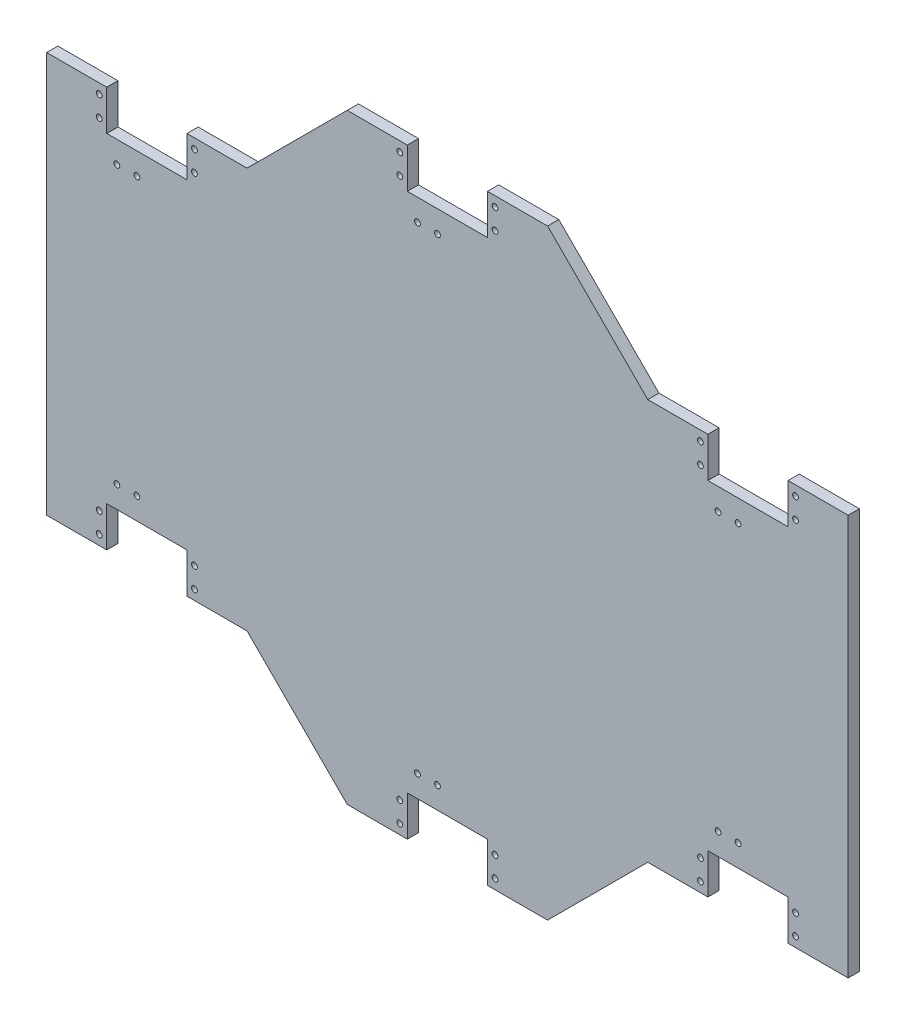
from build123d import *

# Parameters (mm, degrees)
BOSS_EXTRU_1_DEPTH      = 5.6
ENL_V_MAT_EXTRU_1_REACH = 429.237
ESQUISSE2_W             = 40
ESQUISSE2_H             = 20
ENL_V_MAT_EXTRU_2_REACH = 429.237
ESQUISSE3_R             = 1.45
SKETCH2_W               = 40
SKETCH2_H               = 20
CUT_EXTRUDE2_DEPTH      = 428.236889793
SKETCH5_R               = 1.45
CUT_EXTRUDE4_DEPTH      = 428.236889793


with BuildPart() as part:
    # Esquisse1 → Boss.-Extru.1 (new body)
    with BuildSketch(Plane.XY):
        Polygon((100, -100), (150, -150), (250, -150), (300, -100), (400, -100), (400, 0), (25.838605695, 0), (0, 0), (0, -100), align=None)
    boss_extru_1 = extrude(amount=BOSS_EXTRU_1_DEPTH)

    # Esquisse2 → Enlèv. mat.-Extru.1 (cut, up to next)
    with BuildSketch(Plane.XY.offset(5.6), mode=Mode.PRIVATE) as enl_v_mat_extru_1_sk1:
        with Locations((50, -90)):
            Rectangle(ESQUISSE2_W, ESQUISSE2_H)
    enl_v_mat_extru_1_tool1 = extrude(enl_v_mat_extru_1_sk1.sketch, amount=-ENL_V_MAT_EXTRU_1_REACH, mode=Mode.PRIVATE) & part.part
    enl_v_mat_extru_1 = enl_v_mat_extru_1_tool1.solids().sort_by_distance((50, -90, 5.6))[0]
    add(enl_v_mat_extru_1, mode=Mode.SUBTRACT)

    # Esquisse3 → Enlèv. mat.-Extru.2 (cut, up to next)
    with BuildSketch(Plane.XY.offset(5.6), mode=Mode.PRIVATE) as enl_v_mat_extru_2_sk1:
        with Locations((26.25, -95.08)):
            Circle(ESQUISSE3_R)
    enl_v_mat_extru_2_tool1 = extrude(enl_v_mat_extru_2_sk1.sketch, amount=-ENL_V_MAT_EXTRU_2_REACH, mode=Mode.PRIVATE) & part.part
    # Esquisse3 → Enlèv. mat.-Extru.2 (cut, up to next)
    with BuildSketch(Plane.XY.offset(5.6), mode=Mode.PRIVATE) as enl_v_mat_extru_2_sk2:
        with Locations((73.75, -95.08)):
            Circle(ESQUISSE3_R)
    enl_v_mat_extru_2_tool2 = extrude(enl_v_mat_extru_2_sk2.sketch, amount=-ENL_V_MAT_EXTRU_2_REACH, mode=Mode.PRIVATE) & part.part
    # Esquisse3 → Enlèv. mat.-Extru.2 (cut, up to next)
    with BuildSketch(Plane.XY.offset(5.6), mode=Mode.PRIVATE) as enl_v_mat_extru_2_sk3:
        with Locations((73.75, -84.92)):
            Circle(ESQUISSE3_R)
    enl_v_mat_extru_2_tool3 = extrude(enl_v_mat_extru_2_sk3.sketch, amount=-ENL_V_MAT_EXTRU_2_REACH, mode=Mode.PRIVATE) & part.part
    # Esquisse3 → Enlèv. mat.-Extru.2 (cut, up to next)
    with BuildSketch(Plane.XY.offset(5.6), mode=Mode.PRIVATE) as enl_v_mat_extru_2_sk4:
        with Locations((26.25, -84.92)):
            Circle(ESQUISSE3_R)
    enl_v_mat_extru_2_tool4 = extrude(enl_v_mat_extru_2_sk4.sketch, amount=-ENL_V_MAT_EXTRU_2_REACH, mode=Mode.PRIVATE) & part.part
    # Esquisse3 → Enlèv. mat.-Extru.2 (cut, up to next)
    with BuildSketch(Plane.XY.offset(5.6), mode=Mode.PRIVATE) as enl_v_mat_extru_2_sk5:
        with Locations((35.06, -69.09)):
            Circle(ESQUISSE3_R)
    enl_v_mat_extru_2_tool5 = extrude(enl_v_mat_extru_2_sk5.sketch, amount=-ENL_V_MAT_EXTRU_2_REACH, mode=Mode.PRIVATE) & part.part
    # Esquisse3 → Enlèv. mat.-Extru.2 (cut, up to next)
    with BuildSketch(Plane.XY.offset(5.6), mode=Mode.PRIVATE) as enl_v_mat_extru_2_sk6:
        with Locations((45.06, -69.09)):
            Circle(ESQUISSE3_R)
    enl_v_mat_extru_2_tool6 = extrude(enl_v_mat_extru_2_sk6.sketch, amount=-ENL_V_MAT_EXTRU_2_REACH, mode=Mode.PRIVATE) & part.part
    enl_v_mat_extru_2_1 = enl_v_mat_extru_2_tool1.solids().sort_by_distance((26.25, -95.08, 5.6))[0]
    add(enl_v_mat_extru_2_1, mode=Mode.SUBTRACT)
    enl_v_mat_extru_2_2 = enl_v_mat_extru_2_tool2.solids().sort_by_distance((73.75, -95.08, 5.6))[0]
    add(enl_v_mat_extru_2_2, mode=Mode.SUBTRACT)
    enl_v_mat_extru_2_3 = enl_v_mat_extru_2_tool3.solids().sort_by_distance((73.75, -84.92, 5.6))[0]
    add(enl_v_mat_extru_2_3, mode=Mode.SUBTRACT)
    enl_v_mat_extru_2_4 = enl_v_mat_extru_2_tool4.solids().sort_by_distance((26.25, -84.92, 5.6))[0]
    add(enl_v_mat_extru_2_4, mode=Mode.SUBTRACT)
    enl_v_mat_extru_2_5 = enl_v_mat_extru_2_tool5.solids().sort_by_distance((35.06, -69.09, 5.6))[0]
    add(enl_v_mat_extru_2_5, mode=Mode.SUBTRACT)
    enl_v_mat_extru_2_6 = enl_v_mat_extru_2_tool6.solids().sort_by_distance((45.06, -69.09, 5.6))[0]
    add(enl_v_mat_extru_2_6, mode=Mode.SUBTRACT)
    enl_v_mat_extru_2 = enl_v_mat_extru_2_1 + enl_v_mat_extru_2_2 + enl_v_mat_extru_2_3 + enl_v_mat_extru_2_4 + enl_v_mat_extru_2_5 + enl_v_mat_extru_2_6  # Enlèv. mat.-Extru.2 as one shape, for the pattern or mirror that repeats it

    # Sketch2 → Cut-Extrude2 (cut, symmetric)
    with BuildSketch(Plane.XY):
        with Locations((350, -90)):
            Rectangle(SKETCH2_W, SKETCH2_H)
        with Locations((200, -140)):
            Rectangle(SKETCH2_W, SKETCH2_H)
    cut_extrude2 = extrude(amount=CUT_EXTRUDE2_DEPTH, both=True, mode=Mode.SUBTRACT)

    # Sketch5 → Cut-Extrude4 (cut, through all)
    with BuildSketch(Plane.XY):
        with Locations((176.25, -145.08)):
            Circle(SKETCH5_R)
        with Locations((223.75, -145.08)):
            Circle(SKETCH5_R)
        with Locations((223.75, -134.92)):
            Circle(SKETCH5_R)
        with Locations((176.25, -134.92)):
            Circle(SKETCH5_R)
        with Locations((326.25, -95.08)):
            Circle(SKETCH5_R)
        with Locations((373.75, -95.08)):
            Circle(SKETCH5_R)
        with Locations((373.75, -84.92)):
            Circle(SKETCH5_R)
        with Locations((326.25, -84.92)):
            Circle(SKETCH5_R)
        with Locations((185.06, -119.09)):
            Circle(SKETCH5_R)
        with Locations((195.06, -119.09)):
            Circle(SKETCH5_R)
        with Locations((335.06, -69.09)):
            Circle(SKETCH5_R)
        with Locations((345.06, -69.09)):
            Circle(SKETCH5_R)
    cut_extrude4 = extrude(amount=CUT_EXTRUDE4_DEPTH, mode=Mode.SUBTRACT)

    # Mirror1: Boss.-Extru.1, Enlèv. mat.-Extru.1, Enlèv. mat.-Extru.2, Cut-Extrude2, Cut-Extrude4 across plane
    add(boss_extru_1.mirror(Plane.ZX))
    add(enl_v_mat_extru_1.mirror(Plane.ZX), mode=Mode.SUBTRACT)
    add(enl_v_mat_extru_2.mirror(Plane.ZX), mode=Mode.SUBTRACT)
    add(cut_extrude2.mirror(Plane.ZX), mode=Mode.SUBTRACT)
    add(cut_extrude4.mirror(Plane.ZX), mode=Mode.SUBTRACT)


solid = part.part
